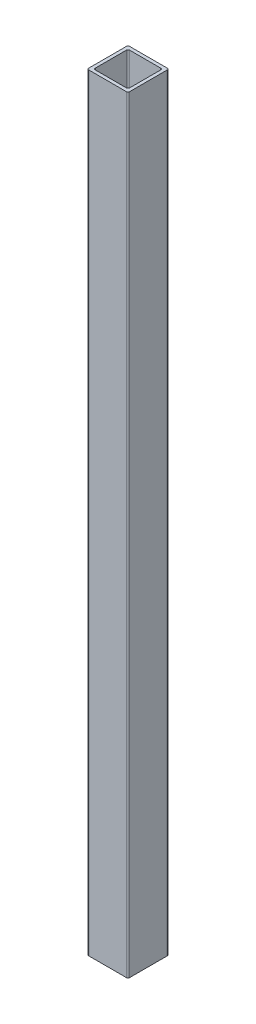
from build123d import *

# Parameters (mm, degrees)
BOSS_EXTRUDE1_DEPTH = 470


with BuildPart() as part:
    # Sketch1 → Boss-Extrude1 (new body)
    with BuildSketch(Plane(origin=(0, 0, 0), x_dir=(1, 0, 0), z_dir=(0, 1, 0))):
        with BuildLine():
            Line((-11.5, -12.5), (11.5, -12.5))
            ThreePointArc((11.5, -12.5), (12.207106781, -12.207106781), (12.5, -11.5))
            Line((12.5, -11.5), (12.5, 11.5))
            ThreePointArc((12.5, 11.5), (12.207106781, 12.207106781), (11.5, 12.5))
            Line((11.5, 12.5), (-11.5, 12.5))
            ThreePointArc((-11.5, 12.5), (-12.207106781, 12.207106781), (-12.5, 11.5))
            Line((-12.5, 11.5), (-12.5, -11.5))
            ThreePointArc((-12.5, -11.5), (-12.207106781, -12.207106781), (-11.5, -12.5))
        make_face()
        with BuildLine():
            Line((-9.5, -10.5), (9.5, -10.5))
            ThreePointArc((9.5, -10.5), (10.207106781, -10.207106781), (10.5, -9.5))
            Line((10.5, -9.5), (10.5, 9.5))
            ThreePointArc((10.5, 9.5), (10.207106781, 10.207106781), (9.5, 10.5))
            Line((9.5, 10.5), (-9.5, 10.5))
            ThreePointArc((-9.5, 10.5), (-10.207106781, 10.207106781), (-10.5, 9.5))
            Line((-10.5, 9.5), (-10.5, -9.5))
            ThreePointArc((-10.5, -9.5), (-10.207106781, -10.207106781), (-9.5, -10.5))
        make_face(mode=Mode.SUBTRACT)
    extrude(amount=BOSS_EXTRUDE1_DEPTH)


solid = part.part
